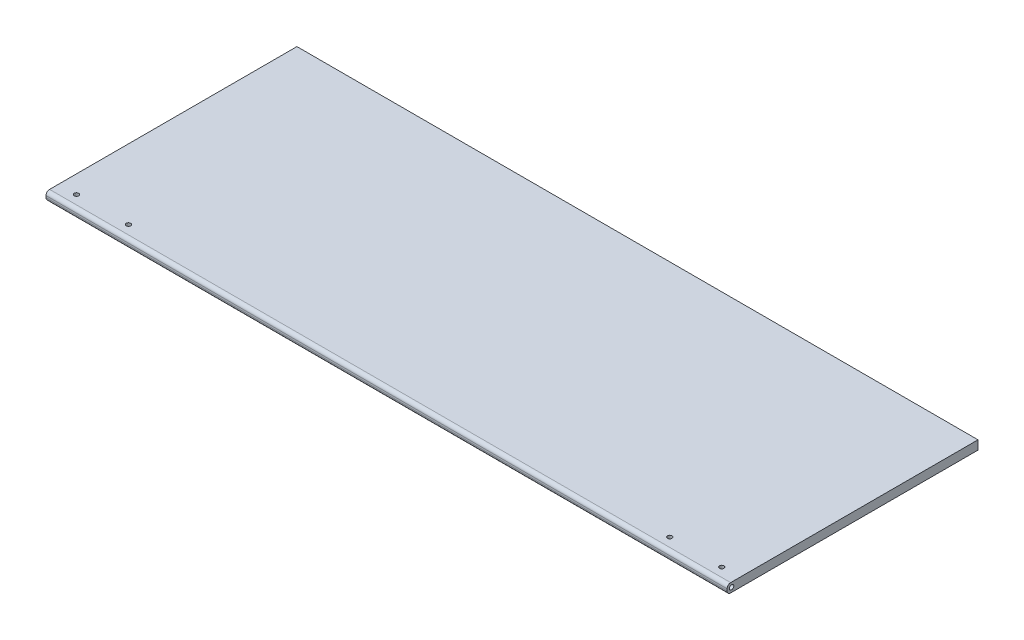
from build123d import *

# Parameters (mm, degrees)
SKETCH1_W           = 482.6
SKETCH1_H           = 177.8
BOSS_EXTRUDE1_DEPTH = 6.35
SKETCH2_R           = 1.5875
CUT_EXTRUDE1_DEPTH  = 491.760932125
FILLET1_R           = 2.54
SKETCH4_R           = 1.5875
CUT_EXTRUDE3_DEPTH  = 258.233789577


with BuildPart() as part:
    # Sketch1 → Boss-Extrude1 (new body)
    with BuildSketch(Plane(origin=(0, 0, 0), x_dir=(1, 0, 0), z_dir=(0, 1, 0))):
        Rectangle(SKETCH1_W, SKETCH1_H)
    extrude(amount=BOSS_EXTRUDE1_DEPTH)

    # Sketch2 → Cut-Extrude1 (cut, through all)
    with BuildSketch(Plane.ZY.offset(241.3)):
        with Locations((85.725, 3.175)):
            Circle(SKETCH2_R)
    extrude(amount=-CUT_EXTRUDE1_DEPTH, mode=Mode.SUBTRACT)

    # Fillet1
    fillet1_edges = [part.edges().sort_by_distance(p)[0] for p in [
        (0, 0, 88.9),
        (0, 6.35, 88.9),
    ]]
    fillet(fillet1_edges, radius=FILLET1_R)

    # Sketch4 → Cut-Extrude3 (cut, through all)
    with BuildSketch(Plane.XZ):
        with Locations((-191.77, 80.01)):
            Circle(SKETCH4_R)
        with Locations((-228.6, 80.01)):
            Circle(SKETCH4_R)
    cut_extrude3 = extrude(amount=-CUT_EXTRUDE3_DEPTH, mode=Mode.SUBTRACT)

    # Mirror1: Cut-Extrude3 across plane
    add(cut_extrude3.mirror(Plane(origin=(0, 0, 0), x_dir=(0, 0, 1), z_dir=(1, 0, 0))), mode=Mode.SUBTRACT)


solid = part.part
